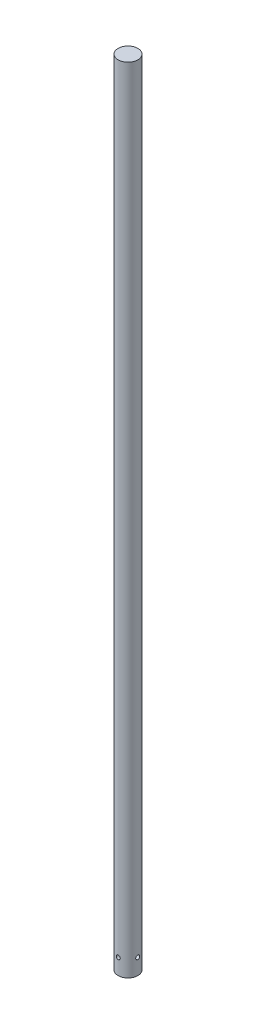
from build123d import *

# Parameters (mm, degrees)
SKETCH1_R                            = 12.5
BOSS_EXTRUDE1_DEPTH                  = 1000
F_8_0_199_DIAMETER_HOLE3_D           = 5.0546
F_8_0_199_DIAMETER_HOLE3_ON_FACE_2_D = 5.0546


with BuildPart() as part:
    # Sketch1 → Boss-Extrude1 (new body)
    with BuildSketch(Plane(origin=(0, 0, 0), x_dir=(1, 0, 0), z_dir=(0, 1, 0))):
        Circle(SKETCH1_R)
    extrude(amount=BOSS_EXTRUDE1_DEPTH)

    # #8 (0.199) Diameter Hole3 (through all)
    with Locations(Plane(origin=(-12.5, 20, 0), x_dir=(0, 0, -1), z_dir=(-1, 0, 0))):
        with Locations((0, 0)):
            Hole(F_8_0_199_DIAMETER_HOLE3_D / 2)

    # #8 (0.199) Diameter Hole3 on face 2 (through all)
    with Locations(Plane(origin=(0, 20, -12.5), x_dir=(-1, 0, 0), z_dir=(0, 0, -1))):
        with Locations((0, 0)):
            Hole(F_8_0_199_DIAMETER_HOLE3_ON_FACE_2_D / 2)


solid = part.part
